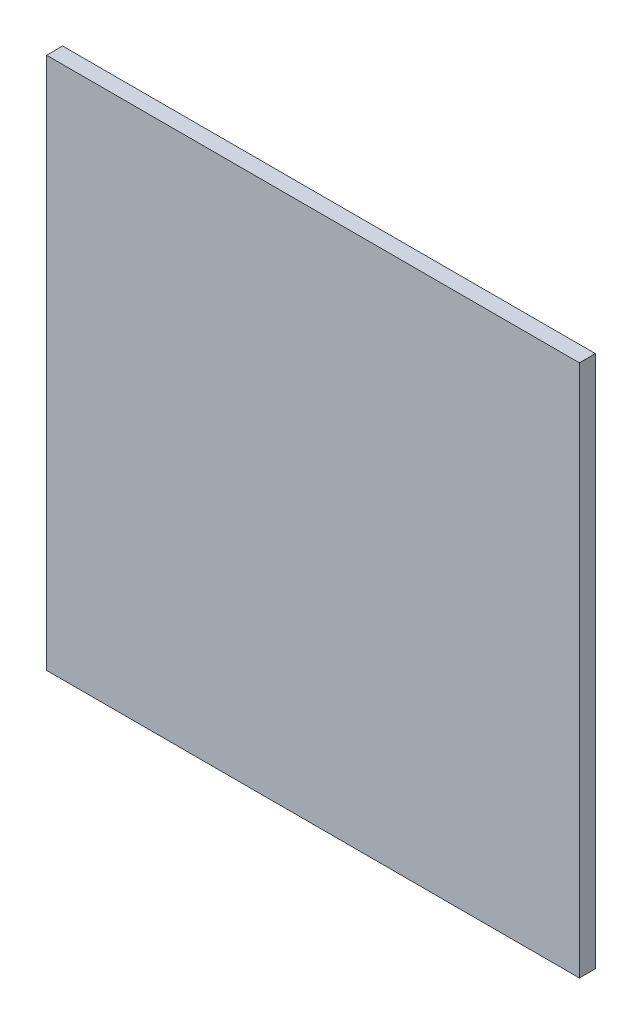
from build123d import *

# Parameters (mm, degrees)
EXTRUDE_1_DEPTH = 15


with BuildPart() as part:
    # 放样1: read off the stored shape, not the designer's step
    # 放样1: loft between two sections, ruled curve by curve
    loft_1_from = [
        Edge.make_bspline([(157.289403045, 194.319437241, 200), (545.928277528, -120.259368848, 200), (231.349471438, -508.898243331, 200), (-157.289403045, -194.319437241, 200), (-545.928277528, 120.259368848, 200), (-231.349471438, 508.898243331, 200), (157.289403045, 194.319437241, 200)], [0, 0, 0, 0, 0.5, 0.5, 0.5, 1, 1, 1, 1], 3, [1, 0.333333333, 0.333333333, 1, 0.333333333, 0.333333333, 1]),
    ]
    loft_1_to = [
        Edge.make_bspline([(42.317097013, 26.631997679, 0), (95.581092372, -58.002196347, 0), (10.946898346, -111.266191705, 0), (-42.317097013, -26.631997679, 0), (-95.581092372, 58.002196347, 0), (-10.946898346, 111.266191705, 0), (42.317097013, 26.631997679, 0)], [0, 0, 0, 0, 0.5, 0.5, 0.5, 1, 1, 1, 1], 3, [1, 0.333333333, 0.333333333, 1, 0.333333333, 0.333333333, 1]),
    ]
    loft_1 = Solid(Shell([*[Face.make_surface_from_curves(loft_1_from[k], loft_1_to[k]) for k in range(1)], Face(Wire(loft_1_from)), Face(Wire(loft_1_to))]))
    add(loft_1)

    # 草图4 → 凸台-拉伸1 (add)
    with BuildSketch(Plane.XY.offset(200)):
        Polygon((0, 250), (-250, 250), (-250, -250), (250, -250), (250, 250), align=None)
    extrude(amount=EXTRUDE_1_DEPTH)


solid = part.part
